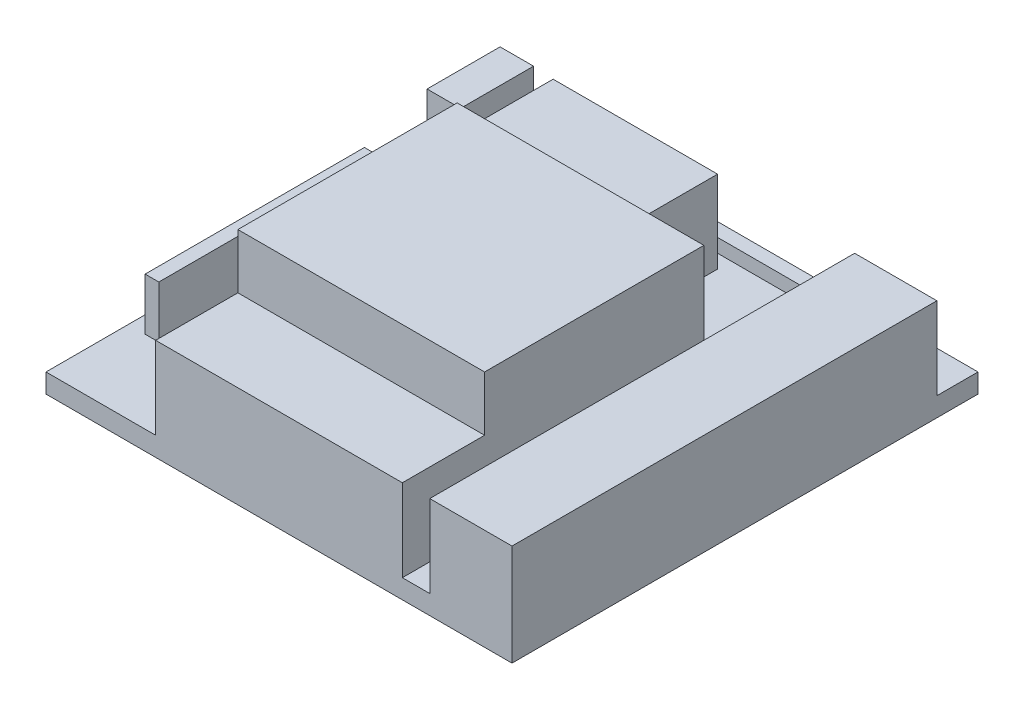
from build123d import *

# Parameters (mm, degrees)
SKETCH1_W                          = 170
SKETCH1_H                          = 170
ALUSPLAAT_DEPTH                    = 2
SKETCH2_W                          = 30
SKETCH2_H                          = 155
PISTIKUD_DEPTH                     = 35
SKETCH3_W                          = 90
SKETCH3_H                          = 110
CPU_M_LUD_DEPTH                    = 55
SKETCH4_W                          = 60
SKETCH4_H                          = 35
SININE_RADIKAS_DEPTH               = 35
SKETCH5_W                          = 90
SKETCH5_H                          = 5
PCIE_PESA_DEPTH                    = 10
SKETCH6_W                          = 12.216790721
SKETCH6_H                          = 26.62710746
RAID_PESAD_DEPTH                   = 30
SKETCH7_W                          = 170
SKETCH7_H                          = 170
LE_LDINE_M_RA_DEPTH                = 5
SKETCH8_W                          = 5
SKETCH8_H                          = 80
PATREI_JA_IGASUGUSED_L_LITID_DEPTH = 19
SKETCH9_OUTSIDE_W                  = 221.416
SKETCH9_OUTSIDE_H                  = 221.416
SKETCH9_OUTSIDE_W_2                = 90
SKETCH9_OUTSIDE_H_2                = 80
CUT_EXTRUDE1_DEPTH                 = 20


with BuildPart() as part:
    # Sketch1 → alusplaat (new body)
    with BuildSketch(Plane(origin=(0, 0, 0), x_dir=(1, 0, 0), z_dir=(0, 1, 0))):
        Rectangle(SKETCH1_W, SKETCH1_H)
    extrude(amount=ALUSPLAAT_DEPTH)

    # Sketch2 → pistikud (add)
    with BuildSketch(Plane(origin=(0, 2, 0), x_dir=(-1, 0, 0), z_dir=(0, 1, 0))):
        with Locations((-70, 7.5)):
            Rectangle(SKETCH2_W, SKETCH2_H)
    extrude(amount=PISTIKUD_DEPTH)

    # Sketch3 → cpu+mälud (add)
    with BuildSketch(Plane(origin=(0, 2, 0), x_dir=(1, 0, 0), z_dir=(0, 1, 0))):
        with Locations((0, -30)):
            Rectangle(SKETCH3_W, SKETCH3_H)
    extrude(amount=CPU_M_LUD_DEPTH)

    # Sketch4 → sinine radikas (add)
    with BuildSketch(Plane(origin=(0, 2, 0), x_dir=(1, 0, 0), z_dir=(0, 1, 0))):
        with Locations((-25, 52.5)):
            Rectangle(SKETCH4_W, SKETCH4_H)
    extrude(amount=SININE_RADIKAS_DEPTH)

    # Sketch5 → pcie pesa (add)
    with BuildSketch(Plane(origin=(0, 2, 0), x_dir=(-1, 0, 0), z_dir=(0, 1, 0))):
        with Locations((0, -77.5)):
            Rectangle(SKETCH5_W, SKETCH5_H)
    extrude(amount=PCIE_PESA_DEPTH)

    # Sketch6 → raid pesad (add)
    with BuildSketch(Plane(origin=(0, 2, 0), x_dir=(-1, 0, 0), z_dir=(0, 1, 0))):
        with Locations((73.780405742, -62.225935716)):
            Rectangle(SKETCH6_W, SKETCH6_H)
    extrude(amount=RAID_PESAD_DEPTH)

    # Sketch7 → üleüldine müra (add)
    with BuildSketch(Plane(origin=(0, 2, 0), x_dir=(-1, 0, 0), z_dir=(0, 1, 0))):
        Rectangle(SKETCH7_W, SKETCH7_H)
    extrude(amount=LE_LDINE_M_RA_DEPTH)

    # Sketch8 → patrei ja igasugused lülitid (add)
    with BuildSketch(Plane(origin=(0, 7, 0), x_dir=(-1, 0, 0), z_dir=(0, 1, 0))):
        with Locations((76.340130234, 15)):
            Rectangle(SKETCH8_W, SKETCH8_H)
    extrude(amount=PATREI_JA_IGASUGUSED_L_LITID_DEPTH)

    # Sketch9 outside → Cut-Extrude1 (cut)
    with BuildSketch(Plane(origin=(0, 57, 0), x_dir=(-1, 0, 0), z_dir=(0, 1, 0))):
        Rectangle(SKETCH9_OUTSIDE_W, SKETCH9_OUTSIDE_H)
        with Locations((0, 15)):
            Rectangle(SKETCH9_OUTSIDE_W_2, SKETCH9_OUTSIDE_H_2, mode=Mode.SUBTRACT)
    extrude(amount=-CUT_EXTRUDE1_DEPTH, mode=Mode.SUBTRACT)


solid = part.part
